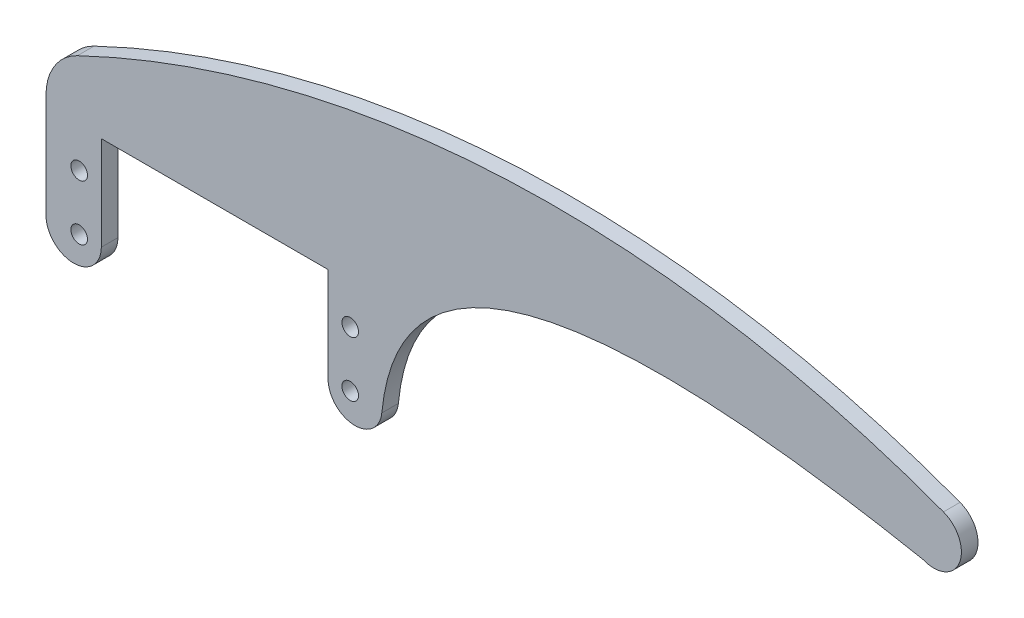
from build123d import *

# Parameters (mm, degrees)
SKETCH1_R           = 1.5
BOSS_EXTRUDE1_DEPTH = 3
FILLET1_R           = 10
FILLET2_START       = -1
FILLET2_DEPTH       = 5
FILLET3_RADIUS      = 5
FILLET3_LENGTH      = 3


with BuildPart() as part:
    # Sketch1 → Boss-Extrude1 (new body)
    with BuildSketch(Plane.XY):
        with BuildLine():
            Line((-40.5, 20), (-40.5, -10))
            Line((-40.5, -10), (-30.5, -10))
            Line((-30.5, -10), (-30.5, 12))
            Line((-30.5, 12), (10.5, 12))
            Line((10.5, 12), (10.5, -10))
            Line((10.5, -10), (20, -10))
            add(Edge.make_bspline(
                [(118.084820575, 20.381332685), (20, 39.436163422), (20, -10)],
                knots=[0, 0, 0, 1, 1, 1], degree=2))
            ThreePointArc((118.084820575, 20.381332685), (124.650748454, 23.164097275), (121.756088913, 29.681468971))
            ThreePointArc((121.756088913, 29.681468971), (39.600152782, 42.067632947), (-40.5, 20))
        make_face()
        with Locations((-34.5, -5)):
            Circle(SKETCH1_R, mode=Mode.SUBTRACT)
        with Locations((-34.5, 5)):
            Circle(SKETCH1_R, mode=Mode.SUBTRACT)
        with Locations((14.5, 5)):
            Circle(SKETCH1_R, mode=Mode.SUBTRACT)
        with Locations((14.5, -5)):
            Circle(SKETCH1_R, mode=Mode.SUBTRACT)
    extrude(amount=BOSS_EXTRUDE1_DEPTH)

    # Fillet1
    fillet1_edges = [part.edges().sort_by_distance(p)[0] for p in [
        (-40.5, 20, 1.5),
    ]]
    fillet(fillet1_edges, radius=FILLET1_R)

    # Fillet2: read off the stored shape, not the designer's step
    # Fillet2 outline → Fillet2 (cut)
    with BuildSketch(Plane.XY.offset(FILLET2_START)):
        with BuildLine():
            add(Edge.make_bspline(
                [(20, -10), (20, -7.730924257), (20.206638038, -5.606140409)],
                knots=[0, 0, 0, 0.045899107, 0.045899107, 0.045899107], degree=2))
            add(Edge.make_bspline(
                [(20.206638038, -5.606140409), (19.985493057, -7.880093874), (18.329539971, -9.999999869), (15.36474074, -10)],
                knots=[0, 0, 0, 0, 0.487277065, 0.487277065, 0.487277065, 0.487277065], degree=3, weights=[1, 0.690889052, 0.53240078, 0.524535183]))
            Line((15.36474074, -10), (20, -10))
        make_face()
        with BuildLine():
            Line((10.5, -10), (15.36474074, -10))
            add(Edge.make_bspline(
                [(15.36474074, -10), (12.147576418, -10.000000142), (10.5, -7.59675874), (10.5, -5.135259475)],
                knots=[0.487277065, 0.487277065, 0.487277065, 0.487277065, 1, 1, 1, 1], degree=3, weights=[0.524535183, 0.51625884, 0.674747113, 1]))
            Line((10.5, -5.135259475), (10.5, -10))
        make_face()
    extrude(amount=FILLET2_DEPTH, mode=Mode.SUBTRACT)

    # Fillet3: full round fillet: the end face becomes a half cylinder, R = half its width
    fillet3_face = Plane((-35.5, -10, 1.5), x_dir=(0, 0, 1), z_dir=(0, -1, 0))  # on the end face: x along it, z out of the body
    fillet3_slab = fillet3_face.offset(-FILLET3_RADIUS / 2) * Box(FILLET3_LENGTH, 2 * FILLET3_RADIUS, FILLET3_RADIUS, mode=Mode.PRIVATE)  # the body's end, R deep
    fillet3_round = Plane((-35.5, -5, 1.5), x_dir=(0, -1, 0), z_dir=(0, 0, 1)) * Cylinder(FILLET3_RADIUS, FILLET3_LENGTH, mode=Mode.PRIVATE)  # its axis R under the face
    add(fillet3_slab - fillet3_round, mode=Mode.SUBTRACT)


solid = part.part
